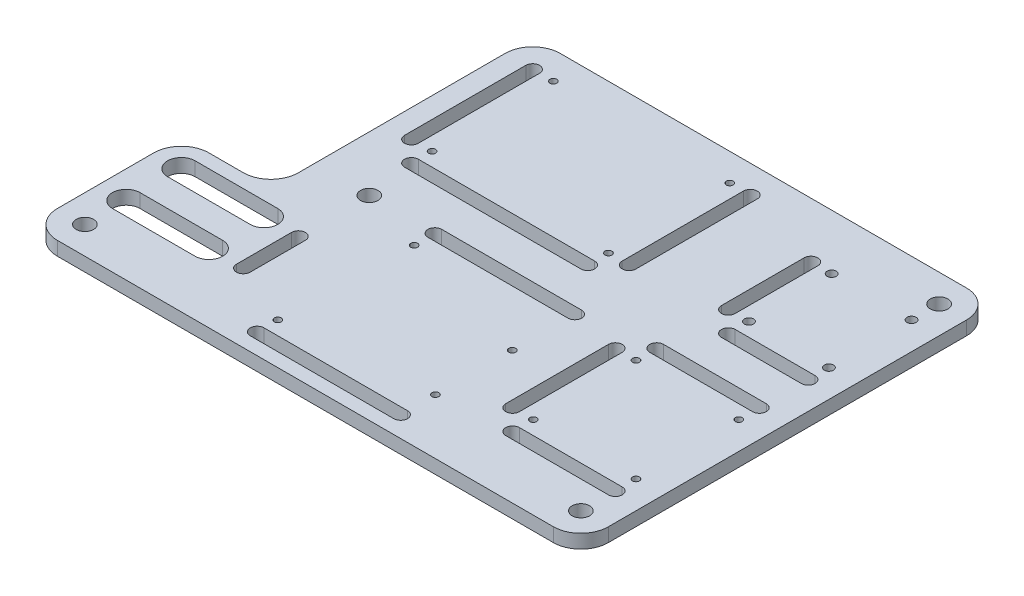
from build123d import *

# Parameters (mm, degrees)
BOSS_EXTRUDE1_DEPTH          = 5
ARDUINO_UNO_HOLES_D          = 2.5
L298N_HOLES_D                = 2.5
PROTOBOARD_HOLES_D           = 2.5
L_BRACKET_HOLES_D            = 3.3
POWER_BLOCK_SLOTS_DEPTH      = 126.099960032
CABLE_MANAGEMENT_SLOTS_DEPTH = 126.099960032
CUT_EXTRUDE3_START           = -10
CUT_EXTRUDE3_DEPTH           = 10
WALL_MOUNTING_HOLES_D        = 6.35


with BuildPart() as part:
    # Sketch1 → Boss-Extrude1 (new body)
    with BuildSketch(Plane(origin=(0, 0, 0), x_dir=(1, 0, 0), z_dir=(0, 1, 0))):
        with BuildLine():
            Line((-90, -75), (90, -75))
            ThreePointArc((90, -75), (97.071067812, -72.071067812), (100, -65))
            Line((100, -65), (100, 65))
            ThreePointArc((100, 65), (97.071067812, 72.071067812), (90, 75))
            Line((90, 75), (-90, 75))
            ThreePointArc((-90, 75), (-97.071067812, 72.071067812), (-100, 65))
            Line((-100, 65), (-100, -65))
            ThreePointArc((-100, -65), (-97.071067812, -72.071067812), (-90, -75))
        make_face()
    extrude(amount=BOSS_EXTRUDE1_DEPTH)

    # arduino uno holes (through all)
    with Locations(Plane(origin=(0, 5, 0), x_dir=(1, 0, 0), z_dir=(0, 1, 0))):
        with Locations((27.1, -27), (27.1, -54.9), (-23.7, -11.8), (-25, -60)):
            Hole(ARDUINO_UNO_HOLES_D / 2)

    # l298n holes (through all)
    with Locations(Plane(origin=(0, 5, 0), x_dir=(1, 0, 0), z_dir=(0, 1, 0))):
        with Locations((52.7, -45), (90, -45), (90, -7.7), (52.7, -7.7)):
            Hole(L298N_HOLES_D / 2)

    # protoboard holes (through all)
    with Locations(Plane(origin=(0, 5, 0), x_dir=(1, 0, 0), z_dir=(0, 1, 0))):
        with Locations((-50, 21), (14, 21), (14, 65), (-50, 65)):
            Hole(PROTOBOARD_HOLES_D / 2)

    # l-bracket holes (through all)
    with Locations(Plane(origin=(0, 5, 0), x_dir=(1, 0, 0), z_dir=(0, 1, 0))):
        with Locations((61, 55), (90, 55), (90, 25), (61, 25)):
            Hole(L_BRACKET_HOLES_D / 2)

    # Sketch24 → power block slots (cut, through all)
    with BuildSketch(Plane(origin=(0, 5, 0), x_dir=(1, 0, 0), z_dir=(0, 1, 0))):
        with BuildLine():
            Line((-60, -35), (-90, -35))
            ThreePointArc((-90, -35), (-95, -30), (-90, -25))
            Line((-90, -25), (-60, -25))
            ThreePointArc((-60, -25), (-55, -30), (-60, -35))
        make_face()
        with BuildLine():
            Line((-60, -45), (-90, -45))
            ThreePointArc((-90, -45), (-95, -50), (-90, -55))
            Line((-90, -55), (-60, -55))
            ThreePointArc((-60, -55), (-55, -50), (-60, -45))
        make_face()
    extrude(amount=-POWER_BLOCK_SLOTS_DEPTH, mode=Mode.SUBTRACT)

    # Sketch26 → cable management slots (cut, through all)
    with BuildSketch(Plane(origin=(0, 5, 0), x_dir=(1, 0, 0), z_dir=(0, 1, 0))):
        with BuildLine():
            Line((-50, 16), (14, 16))
            ThreePointArc((14, 16), (16.5, 13.5), (14, 11))
            Line((14, 11), (-50, 11))
            ThreePointArc((-50, 11), (-52.5, 13.5), (-50, 16))
        make_face()
        with BuildLine():
            Line((24, 65), (24, 21))
            ThreePointArc((24, 21), (21.5, 18.5), (19, 21))
            Line((19, 21), (19, 65))
            ThreePointArc((19, 65), (21.5, 67.5), (24, 65))
        make_face()
        with BuildLine():
            Line((56, 55), (56, 25))
            ThreePointArc((56, 25), (53.5, 22.5), (51, 25))
            Line((51, 25), (51, 55))
            ThreePointArc((51, 55), (53.5, 57.5), (56, 55))
        make_face()
        with BuildLine():
            Line((61, 20), (90, 20))
            ThreePointArc((90, 20), (92.5, 17.5), (90, 15))
            Line((90, 15), (61, 15))
            ThreePointArc((61, 15), (58.5, 17.5), (61, 20))
        make_face()
        with BuildLine():
            Line((52.7, 2.3), (90, 2.3))
            ThreePointArc((90, 2.3), (92.5, -0.2), (90, -2.7))
            Line((90, -2.7), (52.7, -2.7))
            ThreePointArc((52.7, -2.7), (50.2, -0.2), (52.7, 2.3))
        make_face()
        with BuildLine():
            Line((47.7, -7.7), (47.7, -45))
            ThreePointArc((47.7, -45), (45.2, -47.5), (42.7, -45))
            Line((42.7, -45), (42.7, -7.7))
            ThreePointArc((42.7, -7.7), (45.2, -5.2), (47.7, -7.7))
        make_face()
        with BuildLine():
            Line((-25, -65), (27.1, -65))
            ThreePointArc((27.1, -65), (29.6, -67.5), (27.1, -70))
            Line((27.1, -70), (-25, -70))
            ThreePointArc((-25, -70), (-27.5, -67.5), (-25, -65))
        make_face()
        with BuildLine():
            Line((-45, -30), (-45, -50))
            ThreePointArc((-45, -50), (-47.5, -52.5), (-50, -50))
            Line((-50, -50), (-50, -30))
            ThreePointArc((-50, -30), (-47.5, -27.5), (-45, -30))
        make_face()
        with BuildLine():
            Line((-23.7, -1.8), (27.1, -1.8))
            ThreePointArc((27.1, -1.8), (29.6, -4.3), (27.1, -6.8))
            Line((27.1, -6.8), (-23.7, -6.8))
            ThreePointArc((-23.7, -6.8), (-26.2, -4.3), (-23.7, -1.8))
        make_face()
        with BuildLine():
            Line((-55, 65), (-55, 21))
            ThreePointArc((-55, 21), (-57.5, 18.5), (-60, 21))
            Line((-60, 21), (-60, 65))
            ThreePointArc((-60, 65), (-57.5, 67.5), (-55, 65))
        make_face()
        with BuildLine():
            Line((90, -55), (52.7, -55))
            ThreePointArc((52.7, -55), (50.2, -52.5), (52.7, -50))
            Line((52.7, -50), (90, -50))
            ThreePointArc((90, -50), (92.5, -52.5), (90, -55))
        make_face()
    extrude(amount=-CABLE_MANAGEMENT_SLOTS_DEPTH, mode=Mode.SUBTRACT)

    # Sketch27 → Cut-Extrude3 (cut)
    with BuildSketch(Plane(origin=(0, 5, 0), x_dir=(1, 0, 0), z_dir=(0, 1, 0)).offset(CUT_EXTRUDE3_START)):
        with BuildLine():
            Line((-67.5, -10), (-67.5, 65))
            ThreePointArc((-67.5, 65), (-64.571067812, 72.071067812), (-57.5, 75))
            Line((-57.5, 75), (-90, 75))
            ThreePointArc((-90, 75), (-97.071067812, 72.071067812), (-100, 65))
            Line((-100, 65), (-100, -30))
            ThreePointArc((-100, -30), (-97.071067812, -22.928932188), (-90, -20))
            Line((-90, -20), (-77.5, -20))
            ThreePointArc((-77.5, -20), (-70.428932188, -17.071067812), (-67.5, -10))
        make_face()
    extrude(amount=CUT_EXTRUDE3_DEPTH, mode=Mode.SUBTRACT)

    # wall-mounting holes (through all)
    with Locations(Plane(origin=(0, 5, 0), x_dir=(1, 0, 0), z_dir=(0, 1, 0))):
        with Locations((-90, -65), (90, -65), (90, 65), (-47.5, -4.3)):
            Hole(WALL_MOUNTING_HOLES_D / 2)


solid = part.part
